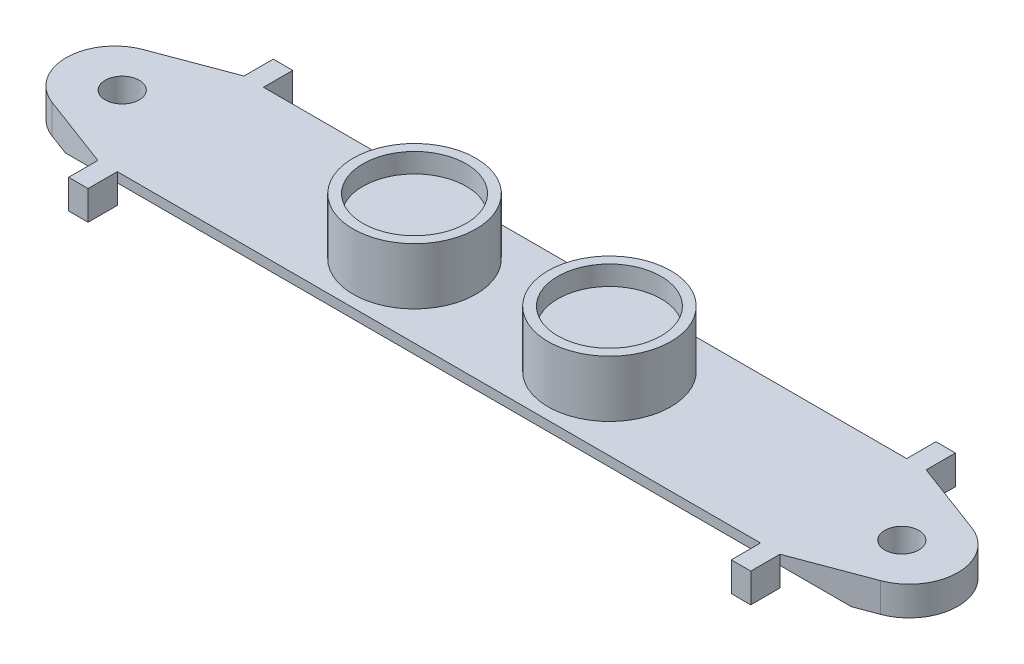
from build123d import *

# Parameters (mm, degrees)
SKETCH1_R           = 1.75
BOSS_EXTRUDE1_DEPTH = 3
SKETCH2_R           = 6.3
BOSS_EXTRUDE2_DEPTH = 3.8
SKETCH3_R           = 6.3
SKETCH3_R_2         = 5.3
BOSS_EXTRUDE3_DEPTH = 2
FILLET1_R           = 5
CHAMFER1_SIZE       = 2
SKETCH5_W           = 2
SKETCH5_H           = 3
BOSS_EXTRUDE4_DEPTH = 3


with BuildPart() as part:
    # Sketch1 → Boss-Extrude1 (new body)
    with BuildSketch(Plane(origin=(0, 0, 0), x_dir=(1, 0, 0), z_dir=(0, 1, 0))):
        Polygon((35, 7.5), (55, 0), (35, -7.5), (-35, -7.5), (-55, 0), (-35, 7.5), align=None)
        with Locations((-40, 0)):
            Circle(SKETCH1_R, mode=Mode.SUBTRACT)
        with Locations((40, 0)):
            Circle(SKETCH1_R, mode=Mode.SUBTRACT)
    extrude(amount=BOSS_EXTRUDE1_DEPTH)

    # Sketch2 → Boss-Extrude2 (add)
    with BuildSketch(Plane(origin=(0, 3, 0), x_dir=(1, 0, 0), z_dir=(0, 1, 0))):
        with Locations((10, 0)):
            Circle(SKETCH2_R)
        with Locations((-10, 0)):
            Circle(SKETCH2_R)
    extrude(amount=BOSS_EXTRUDE2_DEPTH)

    # Sketch3 → Boss-Extrude3 (add)
    # profile 1 of 2: a face of its own
    with BuildSketch(Plane(origin=(0, 6.8, 0), x_dir=(1, 0, 0), z_dir=(0, 1, 0))):
        with Locations((-10, 0)):
            Circle(SKETCH3_R)
        with Locations((-10, 0)):
            Circle(SKETCH3_R_2, mode=Mode.SUBTRACT)
    # profile 2 of 2: a face of its own
    with BuildSketch(Plane(origin=(0, 6.8, 0), x_dir=(1, 0, 0), z_dir=(0, 1, 0))):
        with Locations((10, 0)):
            Circle(SKETCH3_R)
        with Locations((10, 0)):
            Circle(SKETCH3_R_2, mode=Mode.SUBTRACT)
    extrude(amount=BOSS_EXTRUDE3_DEPTH)

    # Fillet1
    fillet1_edges = [part.edges().sort_by_distance(p)[0] for p in [
        (55, 1.5, 0),
        (-55, 1.5, 0),
    ]]
    fillet(fillet1_edges, radius=FILLET1_R)

    # Chamfer1
    chamfer1_edges = [part.edges().sort_by_distance(p)[0] for p in [
        (0, 0, -7.5),
        (0, 0, 7.5),
    ]]
    chamfer(chamfer1_edges, length=CHAMFER1_SIZE)

    # Sketch5 → Boss-Extrude4 (add)
    with BuildSketch(Plane(origin=(0, 3, 0), x_dir=(1, 0, 0), z_dir=(0, 1, 0))):
        with Locations((-34, 9)):
            Rectangle(SKETCH5_W, SKETCH5_H)
        with Locations((34, -9)):
            Rectangle(SKETCH5_W, SKETCH5_H)
        with Locations((-34, -9)):
            Rectangle(SKETCH5_W, SKETCH5_H)
        with Locations((34, 9)):
            Rectangle(SKETCH5_W, SKETCH5_H)
    extrude(amount=-BOSS_EXTRUDE4_DEPTH)


solid = part.part
